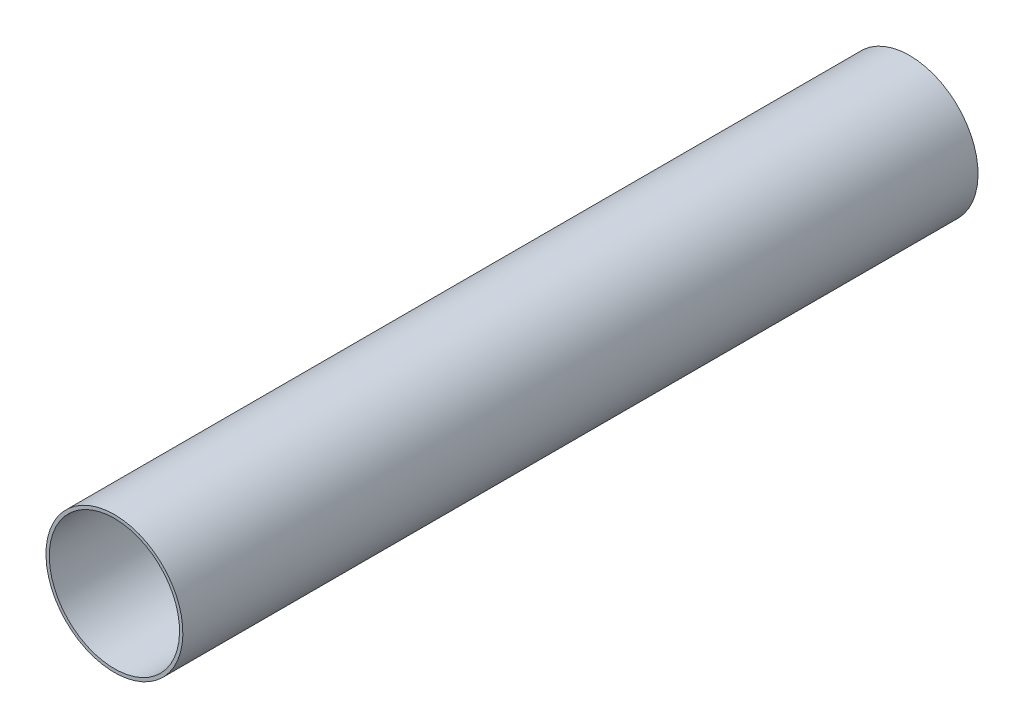
from build123d import *

# Parameters (mm, degrees)
ESQUISSE2_W = 600
ESQUISSE2_H = 2.5


with BuildPart() as part:
    # Esquisse2 → Révolution1 (revolve)
    with BuildSketch(Plane(origin=(0, 0, 0), x_dir=(0, 0, -1), z_dir=(1, 0, 0))):
        with Locations((-310, 50.399)):
            Rectangle(ESQUISSE2_W, ESQUISSE2_H)
    revolve(axis=Axis((0, 0, 0), (0, 0, 1)))


solid = part.part
